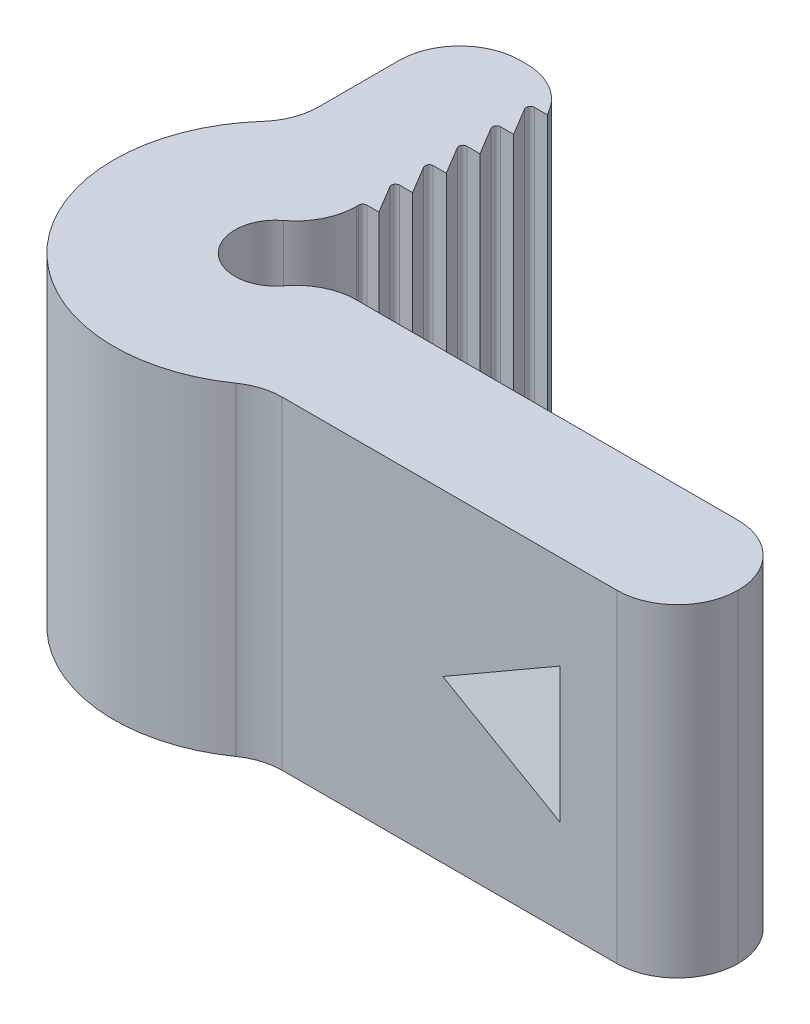
from build123d import *

# Parameters (mm, degrees)
BOSS_EXTRUDE1_DEPTH = 20
CUT_EXTRUDE1_DEPTH  = 88.887054459
CUT_EXTRUDE2_DEPTH  = 102.109516572
LPATTERN1_COUNT     = 6
LPATTERN1_PITCH     = 4.166666667
FILLET1_R           = 0.5
FILLET2_R           = 7.5


with BuildPart() as part:
    # Sketch1 → Boss-Extrude1 (new, symmetric)
    with BuildSketch(Plane(origin=(0, 0, 0), x_dir=(1, 0, 0), z_dir=(0, 1, 0))):
        with BuildLine():
            Line((0, 50.8), (15, 50.8))
            Line((15, 50.8), (15, 25.8))
            Line((15, 25.8), (13, 25.8))
            Line((13, 25.8), (13, 20))
            ThreePointArc((13, 20), (9.464466094, 11.464466094), (18, 15))
            Line((18, 15), (77.733482757, 15))
            Line((77.733482757, 15), (77.733482757, 0))
            Line((77.733482757, 0), (26.228756555, 0))
            ThreePointArc((26.228756555, 0), (-2.099775281, 1.885245467), (0, 30.198684154))
            Line((0, 30.198684154), (0, 50.8))
        make_face()
    extrude(amount=BOSS_EXTRUDE1_DEPTH, both=True)

    # Sketch2 → Cut-Extrude1 (cut, through all)
    with BuildSketch(Plane(origin=(0, 0, -15), x_dir=(-1, 0, 0), z_dir=(0, 0, -1))):
        Polygon((-48.710580838, 0), (-63.173205081, 8.35), (-63.173205081, -8.35), align=None)
    extrude(amount=-CUT_EXTRUDE1_DEPTH, mode=Mode.SUBTRACT)

    # Sketch3 → Cut-Extrude2 (cut, through all)
    with BuildSketch(Plane(origin=(0, 20, 0), x_dir=(1, 0, 0), z_dir=(0, 1, 0))):
        Polygon((15, 25.8), (12.5, 29.966666667), (15, 29.966666667), align=None)
    cut_extrude2 = extrude(amount=-CUT_EXTRUDE2_DEPTH, mode=Mode.SUBTRACT)

    # LPattern1: Cut-Extrude2 ×6
    with Locations(*[(0, 0, -i * LPATTERN1_PITCH) for i in range(1, LPATTERN1_COUNT)]):
        add(cut_extrude2, mode=Mode.SUBTRACT)

    # Fillet1
    fillet1_edges = [part.edges().sort_by_distance(p)[0] for p in [
        (12.5, 0, -46.633333333),
        (13, 0, -25.8),
        (12.5, 0, -29.966666667),
        (12.5, 0, -34.133333333),
        (12.5, 0, -42.466666667),
        (12.5, 0, -38.3),
    ]]
    fillet(fillet1_edges, radius=FILLET1_R)

    # Fillet2
    fillet2_edges = [part.edges().sort_by_distance(p)[0] for p in [
        (12.5, 0, -50.8),
        (77.733482757, 0, -15),
        (77.733482757, 0, 0),
        (26.228756555, 0, 0),
        (0, 0, -30.198684154),
        (0, 0, -50.8),
        (13, 0, -20),
        (18, 0, -15),
    ]]
    fillet(fillet2_edges, radius=FILLET2_R - 0.0001)  # a hair under: the kernel refuses the full size


solid = part.part
